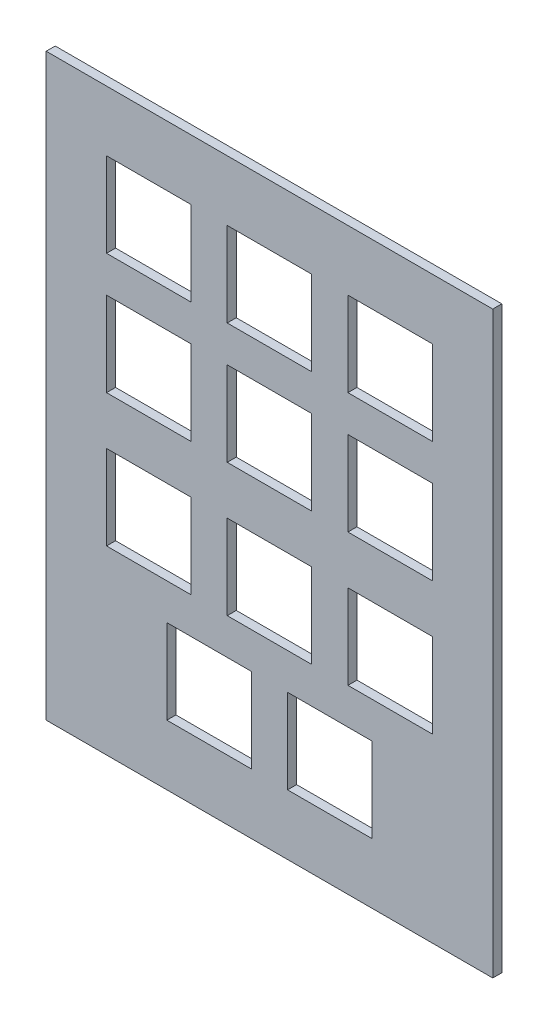
from build123d import *

# Parameters (mm, degrees)
SKETCH1_W           = 74
SKETCH1_H           = 96
SKETCH1_W_2         = 14
SKETCH1_H_2         = 14
BOSS_EXTRUDE1_DEPTH = 1.5


with BuildPart() as part:
    # Sketch1 → Boss-Extrude1 (new body)
    with BuildSketch(Plane.XY):
        with Locations((-37, 48)):
            Rectangle(SKETCH1_W, SKETCH1_H)
        with Locations((-17, 37)):
            Rectangle(SKETCH1_W_2, SKETCH1_H_2, mode=Mode.SUBTRACT)
        with Locations((-17, 79)):
            Rectangle(SKETCH1_W_2, SKETCH1_H_2, mode=Mode.SUBTRACT)
        with Locations((-37, 79)):
            Rectangle(SKETCH1_W_2, SKETCH1_H_2, mode=Mode.SUBTRACT)
        with Locations((-57, 79)):
            Rectangle(SKETCH1_W_2, SKETCH1_H_2, mode=Mode.SUBTRACT)
        with Locations((-17, 59)):
            Rectangle(SKETCH1_W_2, SKETCH1_H_2, mode=Mode.SUBTRACT)
        with Locations((-37, 59)):
            Rectangle(SKETCH1_W_2, SKETCH1_H_2, mode=Mode.SUBTRACT)
        with Locations((-57, 59)):
            Rectangle(SKETCH1_W_2, SKETCH1_H_2, mode=Mode.SUBTRACT)
        with Locations((-37, 37)):
            Rectangle(SKETCH1_W_2, SKETCH1_H_2, mode=Mode.SUBTRACT)
        with Locations((-57, 37)):
            Rectangle(SKETCH1_W_2, SKETCH1_H_2, mode=Mode.SUBTRACT)
        with Locations((-27, 17)):
            Rectangle(SKETCH1_W_2, SKETCH1_H_2, mode=Mode.SUBTRACT)
        with Locations((-47, 17)):
            Rectangle(SKETCH1_W_2, SKETCH1_H_2, mode=Mode.SUBTRACT)
    extrude(amount=BOSS_EXTRUDE1_DEPTH)


solid = part.part
